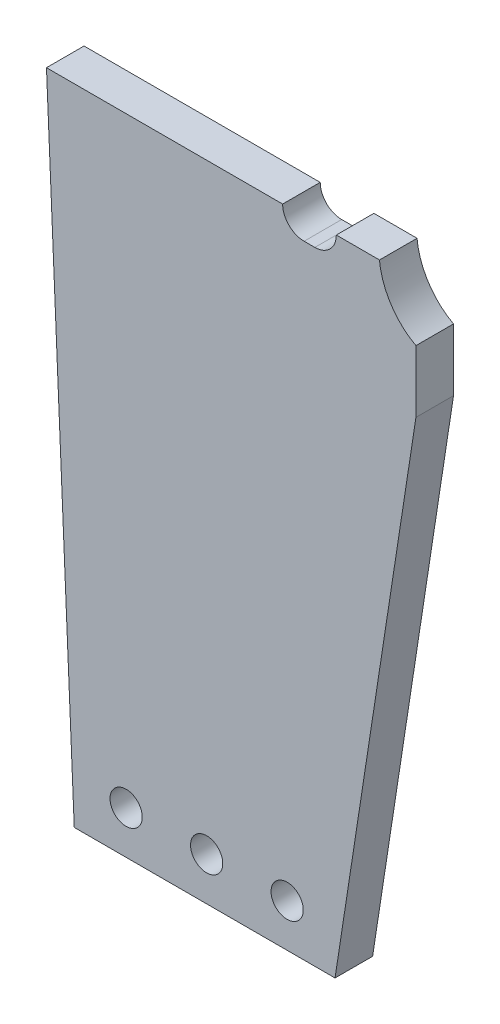
from build123d import *

# Parameters (mm, degrees)
SKETCH1_R           = 4.5
BOSS_EXTRUDE1_DEPTH = 7
SKETCH2_W           = 402.918493315
SKETCH2_H           = 212.645905023
CUT_EXTRUDE1_DEPTH  = 30
SKETCH3_R           = 3
CUT_EXTRUDE2_DEPTH  = 177.473457397


with BuildPart() as part:
    # Sketch1 → Boss-Extrude1 (new body)
    with BuildSketch(Plane.XY):
        with BuildLine():
            Line((22, -50), (-22, -50))
            Line((-22, -50), (-11, -305))
            ThreePointArc((-11, -305), (0, -315.535719965), (11, -305))
            Line((11, -305), (46.838884711, -72))
            Line((46.838884711, -72), (46.838884711, -60.421650598))
            add(Edge.make_bspline(
                [(46.838884711, -60.421650596), (43.068657692, -58.44092391), (40.423050609, -54.296947681), (40.046232129, -50)],
                knots=[0, 0, 0, 0, 0.425250978, 0.425250978, 0.425250978, 0.425250978], degree=3))
            Line((40.046232129, -50), (32, -50))
            ThreePointArc((32, -50), (30.828427125, -52.828427125), (28, -54))
            Line((28, -54), (26, -54))
            ThreePointArc((26, -54), (23.171572875, -52.828427125), (22, -50))
        make_face()
        with Locations((0, -305)):
            Circle(SKETCH1_R, mode=Mode.SUBTRACT)
    extrude(amount=BOSS_EXTRUDE1_DEPTH)

    # Sketch2 → Cut-Extrude1 (cut)
    with BuildSketch(Plane.XY.offset(7)):
        with Locations((44.983042226, -276.322952512)):
            Rectangle(SKETCH2_W, SKETCH2_H)
    extrude(amount=-CUT_EXTRUDE1_DEPTH, mode=Mode.SUBTRACT)

    # Sketch3 → Cut-Extrude2 (cut, through all)
    with BuildSketch(Plane.XY.offset(7)):
        with Locations((-7.159327661, -162)):
            Circle(SKETCH3_R)
        with Locations((7.840672339, -162)):
            Circle(SKETCH3_R)
        with Locations((22.840672339, -162)):
            Circle(SKETCH3_R)
    extrude(amount=-CUT_EXTRUDE2_DEPTH, mode=Mode.SUBTRACT)


solid = part.part
